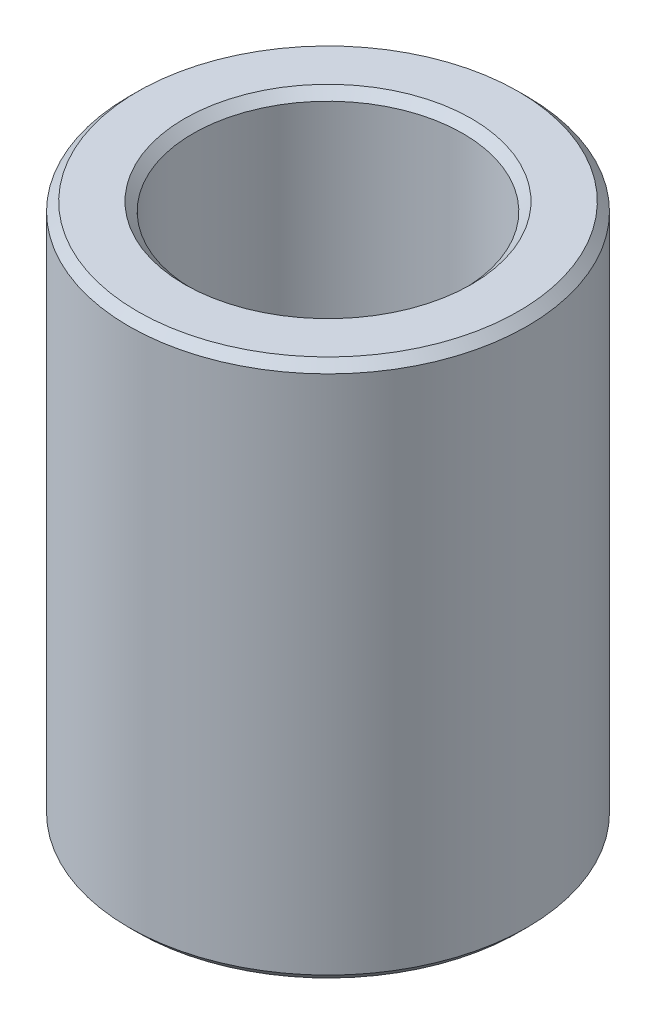
from build123d import *

# Parameters (mm, degrees)
SKETCH1_R           = 60
BOSS_EXTRUDE1_DEPTH = 162.129846578
SKETCH2_R           = 40.681965939
CUT_EXTRUDE1_DEPTH  = 183.992041224
CHAMFER1_SIZE       = 2.59115184


with BuildPart() as part:
    # Sketch1 → Boss-Extrude1 (new body)
    with BuildSketch(Plane(origin=(0, 0, 0), x_dir=(1, 0, 0), z_dir=(0, 1, 0))):
        Circle(SKETCH1_R)
    extrude(amount=BOSS_EXTRUDE1_DEPTH)

    # Sketch2 → Cut-Extrude1 (cut, through all)
    with BuildSketch(Plane(origin=(0, 0, 0), x_dir=(1, 0, 0), z_dir=(0, 1, 0))):
        Circle(SKETCH2_R)
    extrude(amount=CUT_EXTRUDE1_DEPTH, mode=Mode.SUBTRACT)

    # Chamfer1
    chamfer1_edges = [part.edges().sort_by_distance(p)[0] for p in [
        (-40.681965939, 162.129846578, 0),
        (-40.681965939, 0, 0),
        (-60, 0, 0),
        (-60, 162.129846578, 0),
    ]]
    chamfer(chamfer1_edges, length=CHAMFER1_SIZE)


solid = part.part
